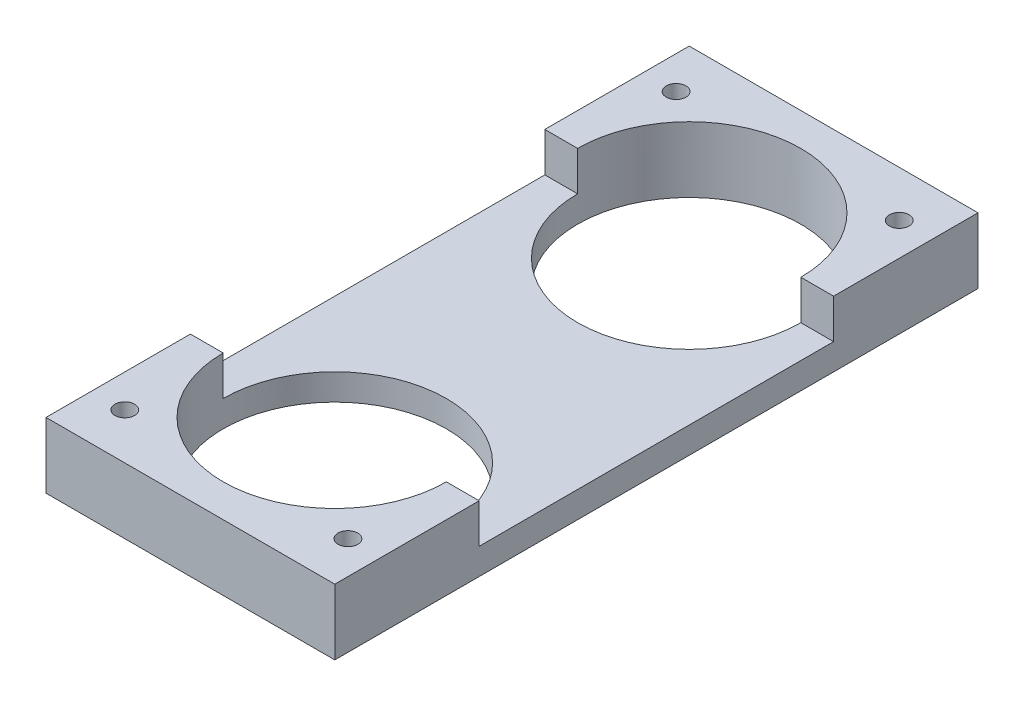
from build123d import *

# Parameters (mm, degrees)
SKETCH_1_W             = 22
SKETCH_1_H             = 49
EXTRUDE_400_DEPTH      = 2
SKETCH_2_W             = 22
SKETCH_2_H             = 11
EXTRUDE_772_DEPTH      = 3
SKETCH_3_R             = 8.5
CUT_EXTRUDE_988_DEPTH  = 28.317576759
SKETCH_4_R             = 0.75
CUT_EXTRUDE_1261_DEPTH = 3


with BuildPart() as part:
    # 草图1 → Extrude 400 (new body)
    with BuildSketch(Plane(origin=(0, 0, 0), x_dir=(1, 0, 0), z_dir=(0, 1, 0))):
        Rectangle(SKETCH_1_W, SKETCH_1_H)
    extrude(amount=EXTRUDE_400_DEPTH)

    # 草图2 → Extrude 772 (add)
    with BuildSketch(Plane(origin=(0, 2, 0), x_dir=(1, 0, 0), z_dir=(0, 1, 0))):
        with Locations((0, 19)):
            Rectangle(SKETCH_2_W, SKETCH_2_H)
        with Locations((0, -19)):
            Rectangle(SKETCH_2_W, SKETCH_2_H)
    extrude(amount=EXTRUDE_772_DEPTH)

    # 草图3 → Cut-Extrude 988 (cut, through all)
    with BuildSketch(Plane.XZ):
        with Locations((0, 13.5)):
            Circle(SKETCH_3_R)
        with Locations((0, -13.5)):
            Circle(SKETCH_3_R)
    extrude(amount=-CUT_EXTRUDE_988_DEPTH, mode=Mode.SUBTRACT)

    # 草图4 → Cut-Extrude 1261 (cut)
    with BuildSketch(Plane(origin=(0, 5, 0), x_dir=(1, 0, 0), z_dir=(0, 1, 0))):
        with Locations((-8.5, -21)):
            Circle(SKETCH_4_R)
        with Locations((8.5, -21)):
            Circle(SKETCH_4_R)
        with Locations((8.5, 21)):
            Circle(SKETCH_4_R)
        with Locations((-8.5, 21)):
            Circle(SKETCH_4_R)
    extrude(amount=-CUT_EXTRUDE_1261_DEPTH, mode=Mode.SUBTRACT)


solid = part.part
